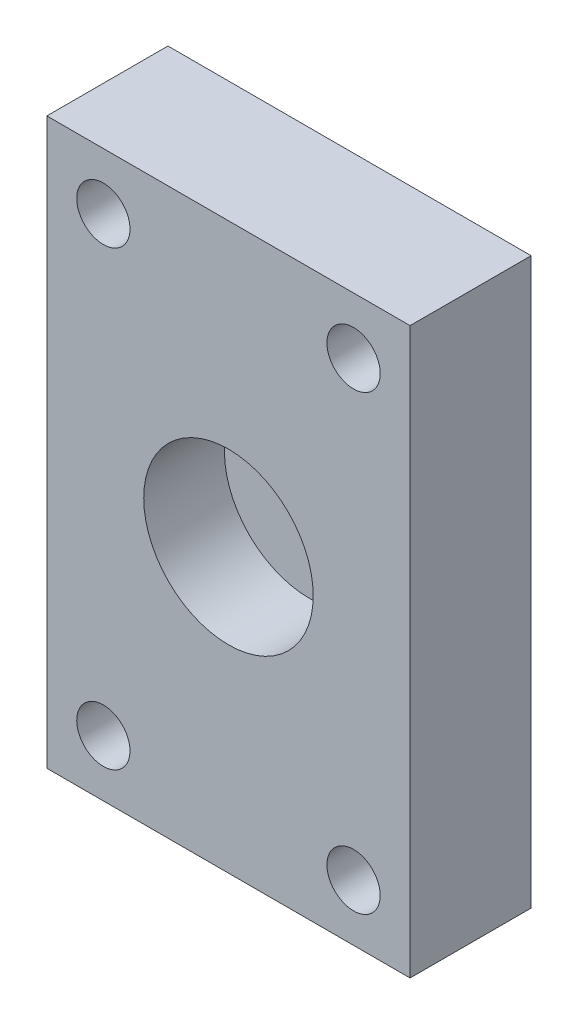
from build123d import *

# Parameters (mm, degrees)
SCHIZZO1_W                   = 45
SCHIZZO1_H                   = 70
ESTRUSIONE_ESTRUSIONE1_DEPTH = 15
SCHIZZO2_R                   = 10.5
SCHIZZO2_R_2                 = 3.3
TAGLIO_ESTRUSIONE1_DEPTH     = 10


with BuildPart() as part:
    # Schizzo1 → Estrusione-Estrusione1 (new body)
    with BuildSketch(Plane.XY):
        with Locations((22.5, 35)):
            Rectangle(SCHIZZO1_W, SCHIZZO1_H)
    extrude(amount=-ESTRUSIONE_ESTRUSIONE1_DEPTH)

    # Schizzo2 → Taglio-Estrusione1 (cut)
    with BuildSketch(Plane.XY):
        with Locations((22.5, 35)):
            Circle(SCHIZZO2_R)
        with Locations((38, 7)):
            Circle(SCHIZZO2_R_2)
        with Locations((38, 63)):
            Circle(SCHIZZO2_R_2)
        with Locations((7, 7)):
            Circle(SCHIZZO2_R_2)
        with Locations((7, 63)):
            Circle(SCHIZZO2_R_2)
    extrude(amount=-TAGLIO_ESTRUSIONE1_DEPTH, mode=Mode.SUBTRACT)


solid = part.part
